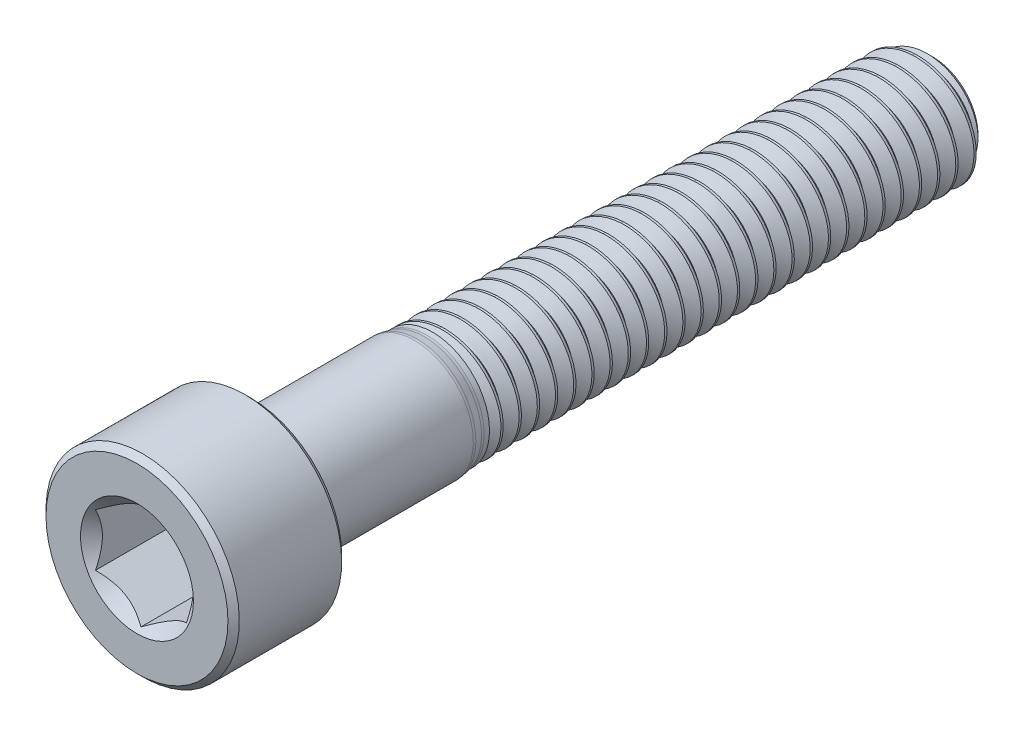
from build123d import *

# Parameters (mm, degrees)
CUT_EXTRUDE1_DEPTH     = 4
SPLIT1_SURFACE_1_BACK  = 38.007
SPLIT1_SURFACE_1_DEPTH = 76.014
SPLIT1_SURFACE_2_BACK  = 38.007
SPLIT1_SURFACE_2_DEPTH = 76.014
CUT_SWEEP1_PITCH       = 0.8
CUT_SWEEP1_TO          = 22


with BuildPart() as part:
    # Sketch2 → Revolve1 (revolve)
    with BuildSketch(Plane(origin=(0, 0, 0), x_dir=(0, 0, -1), z_dir=(1, 0, 0))):
        with BuildLine():
            Line((-17.5, 0), (-17.5, 4))
            Line((-17.5, 4), (-17.25, 4.25))
            Line((-17.25, 4.25), (-12.75, 4.25))
            Line((-12.75, 4.25), (-12.5, 4))
            Line((-12.5, 4), (-12.5, 2.83660254))
            ThreePointArc((-12.5, 2.83660254), (-12.426776695, 2.659825845), (-12.25, 2.58660254))
            Line((-12.25, 2.58660254), (-5.296937498, 2.58660254))
            ThreePointArc((-5.296937498, 2.58660254), (-5.235676786, 2.583592995), (-5.175006047, 2.574593341))
            Line((-5.175006047, 2.574593341), (-4.860374324, 2.5120092))
            ThreePointArc((-4.860374324, 2.5120092), (-4.799703586, 2.503009546), (-4.738442873, 2.5))
            Line((-4.738442873, 2.5), (16.980384758, 2.5))
            Line((16.980384758, 2.5), (17.5, 1.980384758))
            Line((17.5, 1.980384758), (17.5, 0))
            Line((17.5, 0), (-17.5, 0))
        make_face()
    revolve(axis=Axis((0, 0, -17.5), (0, 0, 1)))

    # Sketch3 → Cut-Extrude1 (cut)
    with BuildSketch(Plane.XY.offset(17.5)):
        Polygon((2, -1.154700538), (2, 1.154700538), (0, 2.309401077), (-2, 1.154700538), (-2, -1.154700538), (0, -2.309401077), align=None)
    extrude(amount=-CUT_EXTRUDE1_DEPTH, mode=Mode.SUBTRACT)

    # Cut-Extrude2 cone 1 section (through the dimple's axis) → Cut-Extrude2 (revolve, cut)
    with BuildSketch(Plane(origin=(0, 0, 17.5), x_dir=(0, -1, 0), z_dir=(1, 0, 0))):
        Polygon((0, 0), (2.482606158, 0), (0, 2.482606158), align=None)
    revolve(axis=Axis((0, 0, 17.5), (0, 0, -1)), mode=Mode.SUBTRACT)


with BuildPart() as body_2:
    # Split1: the piece behind the surface
    add(part.part)
    # Split1 surface: a surface, the sketch's curves swept straight by 76.014 mm
    with BuildLine(Plane(origin=(0, 0, 0), x_dir=(0, 0, -1), z_dir=(1, 0, 0)).offset(-SPLIT1_SURFACE_1_BACK), mode=Mode.PRIVATE) as split1_surface_1_path:
        Line((-4.5, -2.5), (-4.5, 2.5))
    split1_surface_1 = Shell.extrude(split1_surface_1_path.wire(), (1 * SPLIT1_SURFACE_1_DEPTH, 0 * SPLIT1_SURFACE_1_DEPTH, 0 * SPLIT1_SURFACE_1_DEPTH))
    split(bisect_by=split1_surface_1, keep=Keep.BOTTOM)

    # Cut-Sweep1: arcs per turn and ends read off the stored shape
    # Cut-Sweep1: the profile of Sketch7 screwed along a right-hand helix through 28.5 turns, 8 arcs to a turn; built about Z, then put on its axis
    cut_sweep1_z = Axis((0, 0, 0), (0, 0, 1))
    cut_sweep1_corners = [(2.54330127, 0, 0.025), (2.54330127, 0, -0.725), (1.980384758, 0, -0.4), (1.980384758, 0, -0.3)]
    with BuildLine(mode=Mode.PRIVATE) as cut_sweep1_profile:
        Line(cut_sweep1_corners[0], cut_sweep1_corners[1])
        Line(cut_sweep1_corners[1], cut_sweep1_corners[2])
        Line(cut_sweep1_corners[2], cut_sweep1_corners[3])
        Line(cut_sweep1_corners[3], cut_sweep1_corners[0])
    cut_sweep1_cap = Face(cut_sweep1_profile.wire())
    cut_sweep1_turn_angles = [0, 22.5, 45, 67.5, 90, 112.5, 135, 157.5, 180, 202.5, 225, 247.5, 270, 292.5, 315, 337.5, 360]
    cut_sweep1_turn_weights = [1, 0.9238795325112867, 1, 0.9238795325112867, 1, 0.9238795325112867, 1, 0.9238795325112867, 1, 0.9238795325112867, 1, 0.9238795325112867, 1, 0.9238795325112867, 1, 0.9238795325112867, 1]
    cut_sweep1_turn_rails = [Edge.make_bspline([Vector(p[0], p[1], 0).rotate(cut_sweep1_z, cut_sweep1_turn_angles[k]) / cut_sweep1_turn_weights[k] + Vector(0, 0, p[2] + CUT_SWEEP1_PITCH * cut_sweep1_turn_angles[k] / 360) for k in range(17)], [0, 0, 0, 1, 1, 2, 2, 3, 3, 4, 4, 5, 5, 6, 6, 7, 7, 8, 8, 8], 2, cut_sweep1_turn_weights) for p in cut_sweep1_corners]
    cut_sweep1_turn_sides = [Face.make_surface_from_curves(cut_sweep1_turn_rails[p[0]], cut_sweep1_turn_rails[p[1]]) for p in [(0, 1), (1, 2), (2, 3), (3, 0)]]
    cut_sweep1_last_angles = [10080, 10102.5, 10125, 10147.5, 10170, 10192.5, 10215, 10237.5, 10260]
    cut_sweep1_last_weights = [1, 0.9238795325112867, 1, 0.9238795325112867, 1, 0.9238795325112867, 1, 0.9238795325116755, 1]
    cut_sweep1_last_rails = [Edge.make_bspline([Vector(p[0], p[1], 0).rotate(cut_sweep1_z, cut_sweep1_last_angles[k]) / cut_sweep1_last_weights[k] + Vector(0, 0, p[2] + CUT_SWEEP1_PITCH * cut_sweep1_last_angles[k] / 360) for k in range(9)], [0, 0, 0, 1, 1, 2, 2, 3, 3, 4, 4, 4], 2, cut_sweep1_last_weights) for p in cut_sweep1_corners]
    cut_sweep1_last_sides = [Face.make_surface_from_curves(cut_sweep1_last_rails[p[0]], cut_sweep1_last_rails[p[1]]) for p in [(0, 1), (1, 2), (2, 3), (3, 0)]]
    cut_sweep1 = Plane(origin=(0, 0, -17.5), x_dir=(0, 1, 0), z_dir=(0, 0, 1)) * split(Solid(Shell([*[p.moved(Location((0, 0, CUT_SWEEP1_PITCH * i))) for i in range(28) for p in cut_sweep1_turn_sides], *cut_sweep1_last_sides, cut_sweep1_cap, cut_sweep1_cap.rotate(cut_sweep1_z, 10260).moved(Location((0, 0, CUT_SWEEP1_PITCH * 10260 / 360)))])), bisect_by=Plane.XY.offset(CUT_SWEEP1_TO), keep=Keep.BOTTOM, mode=Mode.PRIVATE)
    add(cut_sweep1, mode=Mode.SUBTRACT)


with BuildPart() as part_1:
    add(part.part)

    # Split1: split by a surface, the side it looks to stays
    # Split1 surface: a surface, the sketch's curves swept straight by 76.014 mm
    with BuildLine(Plane(origin=(0, 0, 0), x_dir=(0, 0, -1), z_dir=(1, 0, 0)).offset(-SPLIT1_SURFACE_2_BACK), mode=Mode.PRIVATE) as split1_surface_2_path:
        Line((-4.5, -2.5), (-4.5, 2.5))
    split1_surface_2 = Shell.extrude(split1_surface_2_path.wire(), (1 * SPLIT1_SURFACE_2_DEPTH, 0 * SPLIT1_SURFACE_2_DEPTH, 0 * SPLIT1_SURFACE_2_DEPTH))
    split(bisect_by=split1_surface_2, keep=Keep.TOP)

    add(body_2.part)  # Revolve2 merges body 2
    # Sketch8 → Revolve2 (revolve)
    with BuildSketch(Plane(origin=(0, 0, 0), x_dir=(0, 0, -1), z_dir=(1, 0, 0))):
        Polygon((-12.5, 0), (-12.5, 2.5), (-4.5, 2.5), (-3.056624327, 0), align=None)
    revolve(axis=Axis((0, 0, 3.056624327), (0, 0, 1)))


solid = part_1.part
